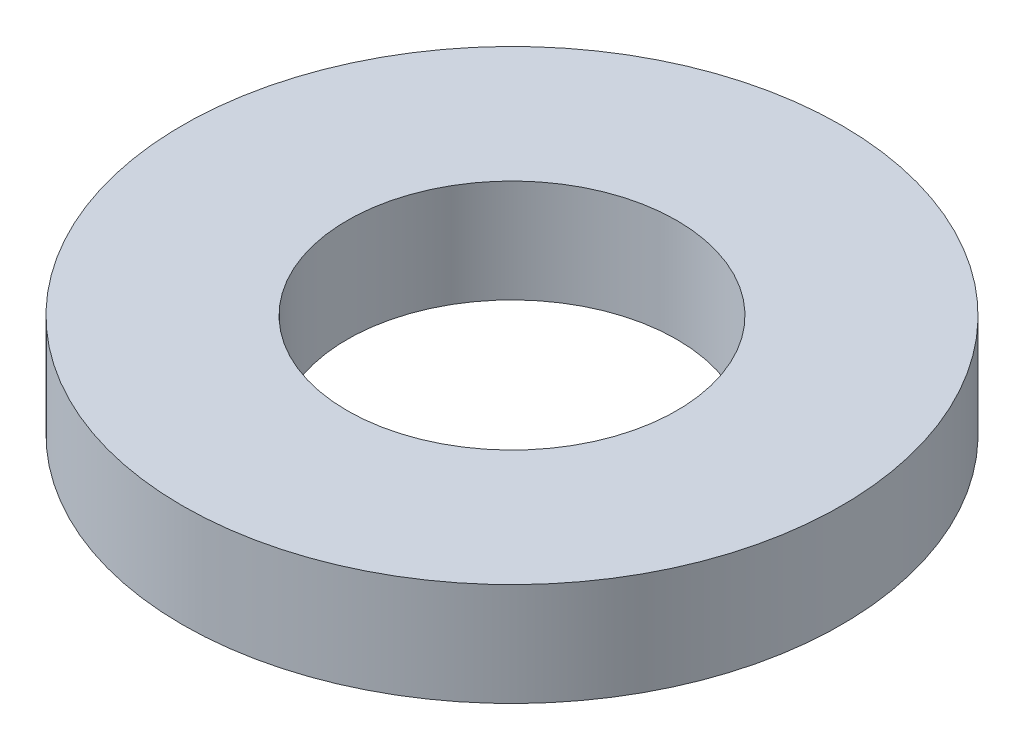
from build123d import *

# Parameters (mm, degrees)
SKETCH1_R           = 80
BOSS_EXTRUDE1_DEPTH = 25
SKETCH2_R           = 40
CUT_EXTRUDE1_DEPTH  = 116.866302263


with BuildPart() as part:
    # Sketch1 → Boss-Extrude1 (new body)
    with BuildSketch(Plane(origin=(0, 0, 0), x_dir=(1, 0, 0), z_dir=(0, 1, 0))):
        Circle(SKETCH1_R)
    extrude(amount=BOSS_EXTRUDE1_DEPTH)

    # Sketch2 → Cut-Extrude1 (cut, through all)
    with BuildSketch(Plane(origin=(0, 0, 0), x_dir=(1, 0, 0), z_dir=(0, 1, 0))):
        Circle(SKETCH2_R)
    extrude(amount=CUT_EXTRUDE1_DEPTH, mode=Mode.SUBTRACT)


solid = part.part
